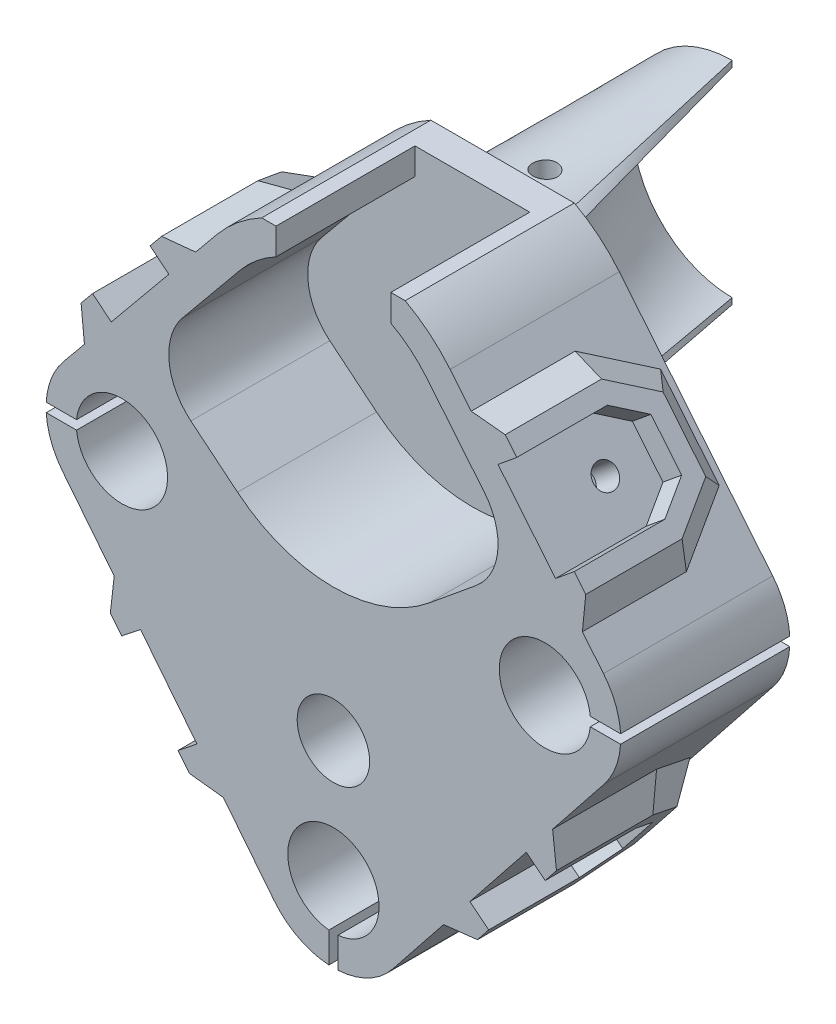
from build123d import *

# Parameters (mm, degrees)
SZKIC1_R                         = 7.550000000001571
SZKIC1_R_2                       = 6.000000000000003
DODANIE_WYCI_GNI_CIE1_DEPTH      = 28
WYTNIJ_WYCI_GNI_CIE1_START       = -23
WYTNIJ_WYCI_GNI_CIE1_DEPTH       = 23
DODANIE_WYCI_GNI_CIE2_DEPTH      = 23
ZAOKR_GLENIE2_R                  = 10
DODANIE_WYCI_GNI_CIE3_DEPTH      = 4
SFAZOWANIE1_SIZE                 = 4
DODANIE_WYCI_GNI_CIE4_DEPTH      = 4
SFAZOWANIE2_SIZE                 = 4
SZKIC8_R                         = 2.0000000000000018
WYTNIJ_WYCI_GNI_CIE4_DEPTH       = 5
SZKIC9_R                         = 1.9999999999999996
WYTNIJ_WYCI_GNI_CIE5_DEPTH       = 5
SFAZOWANIE3_SIZE                 = 4
SZKIC10_R                        = 11
WYTNIJ_WYCI_GNI_CIE6_DEPTH       = 5
SZKIC11_R                        = 1.2500000000000009
SZKIC11_R_2                      = 1.250000000000001
SZKIC11_R_3                      = 1.2500000000000007
WYTNIJ_WYCI_GNI_CIE7_DEPTH       = 5
SZKIC12_R                        = 4.000000000000003
WYTNIJ_WYCI_GNI_CIE8_DEPTH       = 10
SZKIC13_R                        = 18.500000000000007
SZKIC13_R_2                      = 4.0000000000000036
DODANIE_WYCI_GNI_CIE5_DEPTH      = 3
WYTNIJ_WYCI_GNI_CIE11_DEPTH      = 90.33571442468318
SZKIC16_R                        = 4.0000000000000036
WYTNIJ_WYCI_GNI_CIE9_DEPTH       = 35
WYTNIJ_WYCI_GNI_CIE12_DEPTH      = 101.13742659628058
WYTNIJ_WYCI_GNI_CIE12_DEPTH_BACK = 101.13742659628058
SZKIC20_R                        = 2


with BuildPart() as part:
    # Szkic1 → Dodanie-wyciągnięcie1 (new body)
    with BuildSketch(Plane.XY):
        with BuildLine():
            Line((-19.31958004687979, 62.866752245251845), (-44.69842918353365, 31.96510962711642))
            ThreePointArc((-44.69842918353365, 31.96510962711642), (-46.68388664689503, 28.581407297164034), (-47.527569596693525, 24.749999999999982))
            Line((-47.52756959669351, 24.74999999999998), (-42.512655988397164, 24.74999999999998))
            ThreePointArc((-42.51265598839718, 24.74999999999998), (-27.44999999999999, 24.000000000000014), (-42.51265598839717, 23.249999999999975))
            Line((-42.512655988397164, 23.24999999999998), (-47.52756959669352, 23.249999999999982))
            ThreePointArc((-47.52756959669352, 23.249999999999982), (-46.71930706256188, 19.509973054269363), (-44.82164322990438, 16.187329248939687))
            Line((-44.82164322990438, 16.18732924893969), (-9.82164322990438, -27.81267075106031))
            ThreePointArc((-9.82164322990438, -27.81267075106031), (8.21e-15, -32.55), (9.821643229904398, -27.81267075106031))
            Line((9.821643229904394, -27.812670751060306), (44.82164322990439, 16.187329248939694))
            ThreePointArc((44.82164322990438, 16.18732924893969), (46.71930706256188, 19.509973054269366), (47.52756959669352, 23.249999999999986))
            Line((47.52756959669352, 23.249999999999993), (42.512655988397164, 23.24999999999999))
            ThreePointArc((42.51265598839717, 23.249999999999986), (27.44999999999999, 24.00000000000001), (42.51265598839718, 24.74999999999999))
            Line((42.512655988397164, 24.74999999999999), (47.52756959669351, 24.74999999999999))
            ThreePointArc((47.52756959669352, 24.74999999999999), (46.68388664689503, 28.581407297164038), (44.69842918353365, 31.965109627116423))
            Line((44.698429183533655, 31.965109627116426), (19.319580046879793, 62.866752245251845))
            ThreePointArc((19.319580046879786, 62.866752245251845), (15.895577263173283, 66.29587063261175), (11.874342087037947, 68.99999999999999))
            Line((11.874342087037945, 68.99999999999999), (-11.874342087037945, 68.99999999999999))
            ThreePointArc((-11.87434208703795, 68.99999999999999), (-15.895577263173287, 66.29587063261175), (-19.31958004687979, 62.866752245251845))
        make_face()
        with Locations((-6.187e-14, -19.99999999999843)):
            Circle(SZKIC1_R, mode=Mode.SUBTRACT)
        Circle(SZKIC1_R_2, mode=Mode.SUBTRACT)
    extrude(amount=DODANIE_WYCI_GNI_CIE1_DEPTH)

    # Szkic2 → Wytnij-wyciągnięcie1 (cut)
    with BuildSketch(Plane.XY.offset(28).offset(WYTNIJ_WYCI_GNI_CIE1_START)):
        with BuildLine():
            Line((35.186332292131624, 43.54717219837207), (19.319580046879786, 62.866752245251845))
            ThreePointArc((19.319580046879786, 62.866752245251845), (15.895577263173283, 66.29587063261175), (11.874342087037949, 68.99999999999999))
            Line((11.874342087037945, 68.99999999999999), (-11.874342087037942, 68.99999999999999))
            ThreePointArc((-11.874342087037942, 68.99999999999999), (-15.895577263173282, 66.29587063261175), (-19.319580046879793, 62.86675224525184))
            Line((-19.31958004687979, 62.866752245251845), (-35.18633229213163, 43.54717219837205))
            Line((-35.18633229213164, 43.54717219837205), (-15.866752245251847, 27.680419953120204))
            ThreePointArc((-15.866752245251842, 27.680419953120207), (-3.55e-15, 22), (15.866752245251849, 27.680419953120214))
            Line((15.86675224525185, 27.680419953120214), (35.186332292131624, 43.54717219837207))
        make_face()
    extrude(amount=WYTNIJ_WYCI_GNI_CIE1_DEPTH, mode=Mode.SUBTRACT)

    # Szkic4 → Dodanie-wyciągnięcie2 (add)
    with BuildSketch(Plane.XY.offset(5.000000000000001)):
        with BuildLine():
            Line((31.32241628275565, 40.37382174932169), (35.18633229213161, 43.54717219837207))
            Line((35.18633229213161, 43.54717219837207), (19.319580046879793, 62.866752245251845))
            ThreePointArc((19.319580046879793, 62.866752245251845), (15.895577263173287, 66.29587063261175), (11.874342087037945, 68.99999999999999))
            Line((11.874342087037945, 68.99999999999999), (9.499473669630357, 68.99999999999999))
            Line((9.499473669630357, 69), (9.499473669630357, 64.6))
            ThreePointArc((9.499473669630355, 64.6), (12.716461810538629, 62.436696506089405), (15.455664037503837, 59.69340179620148))
            Line((15.455664037503835, 59.69340179620148), (31.32241628275565, 40.3738217493217))
        make_face()
        with BuildLine():
            Line((-9.499473669630353, 64.6), (-9.499473669630355, 69))
            Line((-9.499473669630355, 68.99999999999999), (-11.874342087037942, 68.99999999999999))
            ThreePointArc((-11.874342087037942, 68.99999999999999), (-15.895577263173275, 66.29587063261174), (-19.319580046879786, 62.866752245251845))
            Line((-19.31958004687979, 62.866752245251845), (-35.18633229213164, 43.54717219837205))
            Line((-35.18633229213164, 43.54717219837205), (-31.322416282755672, 40.37382174932168))
            Line((-31.322416282755682, 40.373821749321664), (-15.45566403750383, 59.69340179620147))
            ThreePointArc((-15.45566403750383, 59.69340179620147), (-12.716461810538625, 62.436696506089405), (-9.499473669630351, 64.6))
        make_face()
    extrude(amount=DODANIE_WYCI_GNI_CIE2_DEPTH)

    # Zaokrąglenie2
    zaokr_glenie2_edges = [part.edges().sort_by_distance(p)[0] for p in [
        (-31.322416282755675, 40.37382174932167, 16.5),
        (31.32241628275565, 40.37382174932169, 16.5),
    ]]
    fillet(zaokr_glenie2_edges, radius=ZAOKR_GLENIE2_R)

    # Szkic6 → Dodanie-wyciągnięcie3 (add)
    with BuildSketch(Plane(origin=(42.37131210135847, 34.798640021529614, 0), x_dir=(0, 0, -1), z_dir=(0.7727832018751915, 0.6346700898100739, 0))):
        Polygon((-28.000000000000004, 26.833343701652026), (-28.000000000000004, 23.833343701652026), (-13.000000000000002, 23.833343701652026), (-8, 20.333343701652034), (-8, 12.333343701652028), (-13.000000000000002, 8.83334370165203), (-28, 8.833343701652032), (-28, 5.83334370165203), (-12.0543333075427, 5.83334370165203), (-5, 10.771377016931917), (-5, 21.895310386372145), (-12.0543333075427, 26.833343701652026), align=None)
    dodanie_wyci_gni_cie3 = extrude(amount=DODANIE_WYCI_GNI_CIE3_DEPTH)

    # Sfazowanie1
    sfazowanie1_edges = [part.edges().sort_by_distance(p)[0] for p in [
        (38.66906333033795, 39.30655004493075, 20.02716665377135),
        (25.3409914443264, 55.53499728430977, 20.027166653771353),
        (26.908002468173308, 53.62698268613559, 8.52716665377135),
        (32.00502738733217, 47.42077366462026, 5),
        (37.10205230649103, 41.21456464310493, 8.52716665377135),
    ]]
    chamfer(sfazowanie1_edges, length=SFAZOWANIE1_SIZE - 0.0001)  # a hair under: the kernel refuses the full size

    # Szkic7 → Dodanie-wyciągnięcie4 (add)
    with BuildSketch(Plane(origin=(19.565395207126798, -15.563382551123588, 0), x_dir=(0, 0, -1), z_dir=(0.7826010541756485, -0.6225235658215388, 0))):
        Polygon((-28, 22.84797891648703), (-28, 19.84797891648703), (-13.000000000000002, 19.84797891648703), (-8, 16.34797891648703), (-8, 8.347978916487031), (-13.000000000000002, 4.8479789164870315), (-28, 4.847978916487031), (-28, 1.8479789164870304), (-12.0543333075427, 1.8479789164870304), (-5, 6.78601223176692), (-5, 17.909945601207145), (-12.054333307542692, 22.84797891648703), align=None)
    dodanie_wyci_gni_cie4 = extrude(amount=DODANIE_WYCI_GNI_CIE4_DEPTH)

    # Sfazowanie2
    sfazowanie2_edges = [part.edges().sort_by_distance(p)[0] for p in [
        (20.71580563178133, -14.117152302986465, 20.02716665377135),
        (22.252826685568124, -12.184897263940208, 8.52716665377135),
        (27.252303072907488, -5.899841234142155, 5),
        (32.251779460246844, 0.3852147956558962, 8.527166653771346),
        (33.78880051403364, 2.317469834702152, 20.027166653771346),
    ]]
    chamfer(sfazowanie2_edges, length=SFAZOWANIE2_SIZE - 0.0001)  # a hair under: the kernel refuses the full size

    # Szkic8 → Wytnij-wyciągnięcie4 (cut)
    with BuildSketch(Plane(origin=(42.37131210135847, 34.798640021529614, 0), x_dir=(0, 0, -1), z_dir=(0.7727832018751915, 0.6346700898100739, 0))):
        with Locations(Location((-15, 16.333343701652037, 0), (0, 0, 90))):
            Circle(SZKIC8_R)
    wytnij_wyci_gni_cie4 = extrude(amount=-WYTNIJ_WYCI_GNI_CIE4_DEPTH, mode=Mode.SUBTRACT)

    # Szkic9 → Wytnij-wyciągnięcie5 (cut)
    with BuildSketch(Plane(origin=(19.565395207126798, -15.563382551123588, 0), x_dir=(0, 0, -1), z_dir=(0.7826010541756485, -0.6225235658215388, 0))):
        with Locations(Location((-15, 12.347978916487023, 0), (0, 0, 90))):
            Circle(SZKIC9_R)
    wytnij_wyci_gni_cie5 = extrude(amount=-WYTNIJ_WYCI_GNI_CIE5_DEPTH, mode=Mode.SUBTRACT)

    # Lustro3: Dodanie-wyciągnięcie3, Dodanie-wyciągnięcie4, Wytnij-wyciągnięcie4, Wytnij-wyciągnięcie5 across plane
    add(dodanie_wyci_gni_cie3.mirror(Plane(origin=(0, 0, 0), x_dir=(0, 0, 1), z_dir=(1, 0, 0))))
    add(dodanie_wyci_gni_cie4.mirror(Plane(origin=(0, 0, 0), x_dir=(0, 0, 1), z_dir=(1, 0, 0))))
    add(wytnij_wyci_gni_cie4.mirror(Plane(origin=(0, 0, 0), x_dir=(0, 0, 1), z_dir=(1, 0, 0))), mode=Mode.SUBTRACT)
    add(wytnij_wyci_gni_cie5.mirror(Plane(origin=(0, 0, 0), x_dir=(0, 0, 1), z_dir=(1, 0, 0))), mode=Mode.SUBTRACT)

    # Sfazowanie3
    sfazowanie3_edges = [part.edges().sort_by_distance(p)[0] for p in [
        (-25.340991444326406, 55.534997284309775, 20.027166653771353),
        (-26.908002468173336, 53.6269826861356, 8.52716665377135),
        (-32.00502738733219, 47.42077366462027, 5),
        (-37.102052306491046, 41.214564643104936, 8.52716665377135),
        (-38.66906333033795, 39.30655004493076, 20.02716665377135),
        (-33.78880051403364, 2.317469834702152, 20.027166653771346),
        (-32.25177946024685, 0.3852147956558962, 8.527166653771346),
        (-27.25230307290748, -5.899841234142151, 5),
        (-22.252826685568124, -12.184897263940208, 8.527166653771351),
        (-20.71580563178133, -14.117152302986465, 20.02716665377135),
    ]]
    chamfer(sfazowanie3_edges, length=SFAZOWANIE3_SIZE - 0.0001)  # a hair under: the kernel refuses the full size

    # Szkic10 → Wytnij-wyciągnięcie6 (cut)
    with BuildSketch(Plane(origin=(0, 0, 0), x_dir=(-1, 0, 0), z_dir=(0, 0, -1))):
        Circle(SZKIC10_R)
    extrude(amount=-WYTNIJ_WYCI_GNI_CIE6_DEPTH, mode=Mode.SUBTRACT)

    # Szkic11 → Wytnij-wyciągnięcie7 (cut)
    with BuildSketch(Plane(origin=(0, 0, 5), x_dir=(-1, 0, 0), z_dir=(0, 0, -1))):
        with Locations((0, 8)):
            Circle(SZKIC11_R)
        with Locations((8, 6.5e-16)):
            Circle(SZKIC11_R_2)
        with Locations((1.08e-15, -8)):
            Circle(SZKIC11_R_3)
        with Locations((-8, -1.52e-15)):
            Circle(SZKIC11_R_2)
    extrude(amount=-WYTNIJ_WYCI_GNI_CIE7_DEPTH, mode=Mode.SUBTRACT)

    # Szkic12 → Wytnij-wyciągnięcie8 (cut)
    with BuildSketch(Plane.XY.offset(5.000000000000001)):
        with Locations((0, 47)):
            Circle(SZKIC12_R)
    extrude(amount=-WYTNIJ_WYCI_GNI_CIE8_DEPTH, mode=Mode.SUBTRACT)

    # Szkic13 → Dodanie-wyciągnięcie5 (add)
    with BuildSketch(Plane(origin=(0, 0, 0), x_dir=(-1, 0, 0), z_dir=(0, 0, -1))):
        with Locations(Location((0, 47, 0), (0, 0, 180))):
            Circle(SZKIC13_R)
        with Locations(Location((0, 47, 0), (0, 0, 180))):
            Circle(SZKIC13_R_2, mode=Mode.SUBTRACT)
    extrude(amount=DODANIE_WYCI_GNI_CIE5_DEPTH)

    # Szkic19 → Wytnij-wyciągnięcie11 (cut, through all)
    with BuildSketch(Plane.XY.offset(28)):
        with BuildLine():
            ThreePointArc((0.7500000000000042, -27.512655988397178), (6.82e-15, -27.55), (-0.7499999999999905, -27.512655988397178))
            Line((-0.7499999999999911, -27.51265598839718), (-0.7499999999999902, -34.54855375734602))
            Line((-0.7499999999999902, -34.54855375734602), (0.75000000000001, -34.54855375734602))
            Line((0.75000000000001, -34.54855375734602), (0.75000000000001, -27.51265598839718))
        make_face()
    extrude(amount=-WYTNIJ_WYCI_GNI_CIE11_DEPTH, mode=Mode.SUBTRACT)

    # Wyciągnięcie po profilach1: read off the stored shape, not the designer's step
    # Wyciągnięcie po profilach1: loft between two sections, ruled curve by curve
    wyci_gni_cie_po_profilach1_from = [
        Edge.make_bspline([(8.75, 62.155444566, -3), (8.213107555, 61.845469569, -3), (7.676359744, 61.497345925, -3), (6.617958409, 60.720738592, -3), (6.096304886, 60.292254904, -3), (5.082897153, 59.350864729, -3), (4.591396635, 58.837691187, -3), (3.657077585, 57.730193534, -3), (3.214259052, 57.135869422, -3), (2.395579259, 55.86987697, -3), (2.020190237, 55.198174865, -3), (1.353483217, 53.791541783, -3), (1.062165219, 53.056610805, -3), (0.579769521, 51.537702862, -3), (0.389109857, 50.754092578, -3), (0.115882252, 49.160648451, -3), (0.03331431, 48.35081461, -3), (-0.0167145, 46.72701244, -3), (0.015842732, 45.913631629, -3), (0.19045825, 44.306389604, -3), (0.332516536, 43.512528388, -3), (0.720491938, 41.966804598, -3), (0.966014385, 41.215333743, -3), (1.544863274, 39.770325493, -3), (1.878189717, 39.076788098, -3), (2.6173811, 37.762798147, -3), (3.022772621, 37.142340963, -3), (3.887141016, 35.979426341, -3), (4.346117891, 35.436968904, -3), (5.299650691, 34.434977939, -3), (5.793936964, 33.975193479, -3), (6.802522208, 33.13490297, -3), (7.316821179, 32.754396921, -3), (7.833612973, 32.411958259, -3)], [0, 0, 0, 0, 0.0624999999999999, 0.0624999999999999, 0.125, 0.125, 0.1875, 0.1875, 0.25, 0.25, 0.3125, 0.3125, 0.375, 0.375, 0.4375, 0.4375, 0.5, 0.5, 0.5625, 0.5625, 0.625, 0.625, 0.6875, 0.6875, 0.75, 0.75, 0.8125, 0.8125, 0.875, 0.875, 0.9375, 0.9375, 1, 1, 1, 1], 3),
        Edge.make_bspline([(7.833612973, 32.411958259, -3), (7.983359506, 32.312732607, -3), (8.134670796, 32.215791361, -3), (8.440205576, 32.026612235, -3), (8.594429066, 31.934374355, -3), (8.75, 31.844555434, -3)], [0, 0, 0, 0, 0.5, 0.5, 1, 1, 1, 1], 3),
        Edge.make_bspline([(6.931395906, 63.06878187, -3), (7.242834763, 62.934440261, -3), (7.550617332, 62.790900477, -3), (8.157331495, 62.486197172, -3), (8.45626309, 62.325033651, -3), (8.75, 62.155444566, -3)], [0, 0, 0, 0, 0.5, 0.5, 1, 1, 1, 1], 3),
        Edge.make_bspline([(8.75, 31.844555434, -3), (-3.834728077, 24.578759291, -3), (-16.625455823, 31.475458363, -3), (-18.315329717, 60.489472625, -3), (-6.41174619, 68.824451543, -3), (6.931395906, 63.06878187, -3)], [0, 0, 0, 0, 0.5, 0.5, 1, 1, 1, 1], 3, [1, 0.466923106770813, 0.319056832838091, 0.319056832838091, 0.466923106770813, 1]),
    ]
    wyci_gni_cie_po_profilach1_to = [
        Edge.make_bspline([(0, 63.5, -38), (-0.6875, 63.5, -38), (-1.418396116, 63.457357663, -38), (-2.962134858, 63.250606939, -38), (-3.7752, 63.0864, -38), (-5.4648, 62.5936, -38), (-6.341560409, 62.264739301, -38), (-8.119113748, 61.398182048, -38), (-9.02, 60.86, -38), (-10.78, 59.54, -38), (-11.638862826, 58.757553012, -38), (-13.224150873, 56.941077125, -38), (-13.94982699, 55.906574394, -38), (-15.167820069, 53.62283737, -38), (-15.659053254, 52.373727811, -38), (-16.32556213, 49.749349112, -38), (-16.5, 48.375, -38), (-16.5, 45.625, -38), (-16.32556213, 44.250650888, -38), (-15.659053254, 41.626272189, -38), (-15.167820069, 40.37716263, -38), (-13.94982699, 38.093425606, -38), (-13.224150873, 37.058922875, -38), (-11.638862826, 35.242446988, -38), (-10.78, 34.46, -38), (-9.02, 33.14, -38), (-8.119113748, 32.601817952, -38), (-6.341560409, 31.735260699, -38), (-5.4648, 31.4064, -38), (-3.7752, 30.9136, -38), (-2.962134858, 30.749393061, -38), (-1.418396116, 30.542642337, -38), (-0.6875, 30.5, -38), (0, 30.5, -38)], [0, 0, 0, 0, 0.0624999999999999, 0.0624999999999999, 0.125, 0.125, 0.1875, 0.1875, 0.25, 0.25, 0.3125, 0.3125, 0.375, 0.375, 0.4375, 0.4375, 0.5, 0.5, 0.5625, 0.5625, 0.625, 0.625, 0.6875, 0.6875, 0.75, 0.75, 0.8125, 0.8125, 0.875, 0.875, 0.9375, 0.9375, 1, 1, 1, 1], 3),
        Edge.make_bspline([(0, 30.5, -38), (0, 30.333333333, -38), (0, 30.166666667, -38), (0, 29.833333333, -38), (0, 29.666666667, -38), (0, 29.5, -38)], [0, 0, 0, 0, 0.5, 0.5, 1, 1, 1, 1], 3),
        Edge.make_bspline([(0, 64.5, -38), (0, 64.333333333, -38), (0, 64.166666667, -38), (0, 63.833333333, -38), (0, 63.666666667, -38), (0, 63.5, -38)], [0, 0, 0, 0, 0.5, 0.5, 1, 1, 1, 1], 3),
        Edge.make_bspline([(0, 29.5, -38), (-8.75, 29.5, -38), (-17.5, 35.333333333, -38), (-17.5, 58.666666667, -38), (-8.75, 64.5, -38), (0, 64.5, -38)], [0, 0, 0, 0, 0.5, 0.5, 1, 1, 1, 1], 3, [1, 0.666666666666667, 0.5, 0.5, 0.666666666666667, 1]),
    ]
    wyci_gni_cie_po_profilach1 = Solid(Shell([*[Face.make_surface_from_curves(wyci_gni_cie_po_profilach1_from[k], wyci_gni_cie_po_profilach1_to[k]) for k in range(4)], Face(Wire(wyci_gni_cie_po_profilach1_from)), Face(Wire(wyci_gni_cie_po_profilach1_to))]))
    add(wyci_gni_cie_po_profilach1)

    # Szkic16 → Wytnij-wyciągnięcie9 (cut)
    with BuildSketch(Plane.XY.offset(5.000000000000001)):
        with Locations((0, 47)):
            Circle(SZKIC16_R)
    extrude(amount=-WYTNIJ_WYCI_GNI_CIE9_DEPTH, mode=Mode.SUBTRACT)

    # Szkic20 → Wytnij-wyciągnięcie12 (cut, two sides: drawn at the far end of the back side and taken through both)
    with BuildSketch(Plane(origin=(0, 47, 0), x_dir=(1, 0, 0), z_dir=(0, 1, 0)).offset(-WYTNIJ_WYCI_GNI_CIE12_DEPTH_BACK)):
        with Locations(Location((0, 7, 0), (0, 0, 270))):
            Circle(SZKIC20_R)
    extrude(amount=WYTNIJ_WYCI_GNI_CIE12_DEPTH + WYTNIJ_WYCI_GNI_CIE12_DEPTH_BACK, mode=Mode.SUBTRACT)


solid = part.part
